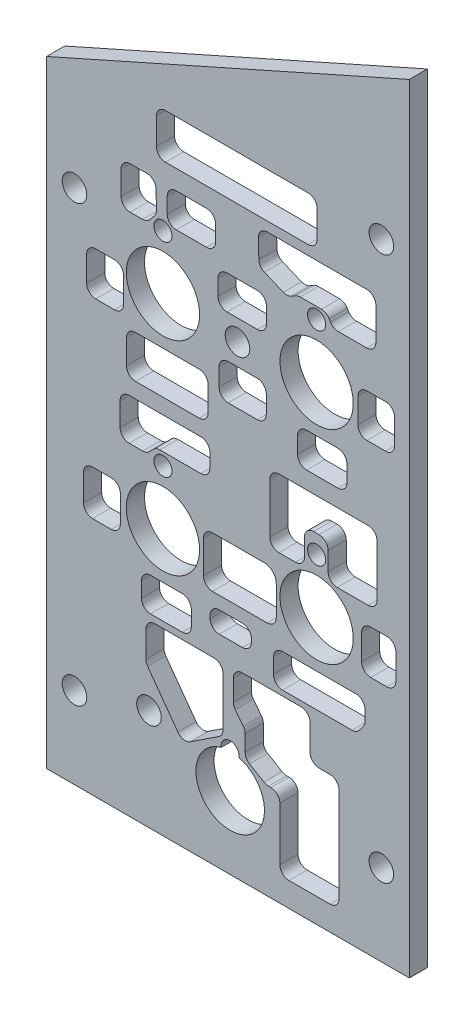
from build123d import *

# Parameters (mm, degrees)
BOSS_EXTRUDE1_DEPTH   = 3.175
F_6_CLEARANCE_HOLE1_D = 4.3053
SKETCH8_R             = 1.5875
SKETCH8_R_2           = 3.75
SKETCH8_R_3           = 6.4135
CUT_EXTRUDE1_DEPTH    = 151.327221464
F_6_CLEARANCE_HOLE2_D = 4.3053
SKETCH11_R            = 6
CUT_EXTRUDE2_DEPTH    = 151.327221464


with BuildPart() as part:
    # Sketch1 → Boss-Extrude1 (new body)
    with BuildSketch(Plane.XY):
        Polygon((0, 107.95), (0, 0), (63.5, 0), (63.5, 136.2202), align=None)
    extrude(amount=-BOSS_EXTRUDE1_DEPTH)

    # #6 Clearance Hole1 (through all)
    with Locations(Plane.XY):
        with Locations((58.6105, 14.2875), (4.8895, 14.2875), (4.8895, 90.4875), (58.6105, 109.5375)):
            Hole(F_6_CLEARANCE_HOLE1_D / 2)

    # Sketch8 → Cut-Extrude1 (cut, through all)
    with BuildSketch(Plane.XY):
        with Locations((20.373230618, 91.71042385)):
            Circle(SKETCH8_R)
        with Locations((47.270485986, 91.71042385)):
            Circle(SKETCH8_R)
        with Locations((47.270485986, 56.073006151)):
            Circle(SKETCH8_R)
        with Locations((32.1439032, 12.7)):
            Circle(SKETCH8_R_2)
        with Locations((20.373230618, 56.073006151)):
            Circle(SKETCH8_R)
        with Locations((32.1439032, 18.7)):
            Circle(SKETCH8_R)
        with Locations((47.270485986, 46.548006151)):
            Circle(SKETCH8_R_3)
        with Locations((47.270485986, 82.18542385)):
            Circle(SKETCH8_R_3)
        with Locations((20.373230618, 82.18542385)):
            Circle(SKETCH8_R_3)
        with Locations((20.373230618, 46.548006151)):
            Circle(SKETCH8_R_3)
    extrude(amount=-CUT_EXTRUDE1_DEPTH, mode=Mode.SUBTRACT)

    # #6 Clearance Hole2 (through all)
    with Locations(Plane(origin=(31.75, 0, 4.765), x_dir=(1, 0, 0), z_dir=(0, 0, 1))):
        with Locations((1.676331213, 81.383391323), (-13.818696068, 17.771227958)):
            Hole(F_6_CLEARANCE_HOLE2_D / 2)

    # Sketch11 → Cut-Extrude2 (cut, through all)
    with BuildSketch(Plane.XY):
        with Locations((32.1439032, 12.7)):
            Circle(SKETCH11_R)
        with BuildLine():
            Line((45.523676241, 74.055426428), (50.989810335, 74.055426428))
            ThreePointArc((50.989810335, 74.055426428), (52.11234235, 73.590458443), (52.577310335, 72.467926428))
            Line((52.577310335, 72.467926428), (52.577310335, 69.601273995))
            ThreePointArc((52.577310335, 69.601273995), (52.11234235, 68.47874198), (50.989810335, 68.013773995))
            Line((50.989810335, 68.013773995), (45.523676241, 68.013773995))
            ThreePointArc((45.523676241, 68.013773995), (44.401144226, 68.47874198), (43.936176241, 69.601273995))
            Line((43.936176241, 69.601273995), (43.936176241, 72.467926428))
            ThreePointArc((43.936176241, 72.467926428), (44.401144226, 73.590458443), (45.523676241, 74.055426428))
        make_face()
        with BuildLine():
            Line((13.983415793, 72.318820405), (13.983415793, 68.071021042))
            ThreePointArc((13.983415793, 68.071021042), (14.448383778, 66.948489027), (15.570915793, 66.483521042))
            Line((15.570915793, 66.483521042), (26.702565391, 66.483521042))
            ThreePointArc((26.702565391, 66.483521042), (27.825097406, 66.948489027), (28.290065391, 68.071021042))
            Line((28.290065391, 68.071021042), (28.290065391, 72.318820405))
            ThreePointArc((28.290065391, 72.318820405), (27.825097406, 73.441352421), (26.702565391, 73.906320405))
            Line((26.702565391, 73.906320405), (15.570915793, 73.906320405))
            ThreePointArc((15.570915793, 73.906320405), (14.448383778, 73.441352421), (13.983415793, 72.318820405))
        make_face()
        with BuildLine():
            Line((56.07814516, 85.295840275), (59.34067888, 85.295840275))
            ThreePointArc((59.34067888, 85.295840275), (60.463210895, 84.83087229), (60.92817888, 83.708340275))
            Line((60.92817888, 83.708340275), (60.92817888, 79.372884269))
            ThreePointArc((60.92817888, 79.372884269), (60.463210895, 78.250352254), (59.34067888, 77.785384269))
            Line((59.34067888, 77.785384269), (56.07814516, 77.785384269))
            ThreePointArc((56.07814516, 77.785384269), (54.955613145, 78.250352254), (54.49064516, 79.372884269))
            Line((54.49064516, 79.372884269), (54.49064516, 83.708340275))
            ThreePointArc((54.49064516, 83.708340275), (54.955613145, 84.83087229), (56.07814516, 85.295840275))
        make_face()
        with BuildLine():
            Line((8.60637042, 83.087952485), (11.892835479, 83.087952485))
            ThreePointArc((11.892835479, 83.087952485), (13.015367495, 82.6229845), (13.480335479, 81.500452485))
            Line((13.480335479, 81.500452485), (13.480335479, 77.084967994))
            ThreePointArc((13.480335479, 77.084967994), (13.015367495, 75.962435979), (11.892835479, 75.497467994))
            Line((11.892835479, 75.497467994), (8.60637042, 75.497467994))
            ThreePointArc((8.60637042, 75.497467994), (7.483838405, 75.962435979), (7.01887042, 77.084967994))
            Line((7.01887042, 77.084967994), (7.01887042, 81.500452485))
            ThreePointArc((7.01887042, 81.500452485), (7.483838405, 82.6229845), (8.60637042, 83.087952485))
        make_face()
        with BuildLine():
            Line((31.78828822, 77.600934156), (36.873010207, 77.600934156))
            ThreePointArc((36.873010207, 77.600934156), (37.995542222, 77.135966171), (38.460510207, 76.013434156))
            Line((38.460510207, 76.013434156), (38.460510207, 72.919427405))
            ThreePointArc((38.460510207, 72.919427405), (37.995542222, 71.79689539), (36.873010207, 71.331927405))
            Line((36.873010207, 71.331927405), (31.78828822, 71.331927405))
            ThreePointArc((31.78828822, 71.331927405), (30.665756205, 71.79689539), (30.20078822, 72.919427405))
            Line((30.20078822, 72.919427405), (30.20078822, 76.013434156))
            ThreePointArc((30.20078822, 76.013434156), (30.665756205, 77.135966171), (31.78828822, 77.600934156))
        make_face()
        with BuildLine():
            Line((20.81246614, 110.162219106), (45.783635223, 110.162219106))
            ThreePointArc((45.783635223, 110.162219106), (46.906167239, 109.697251121), (47.371135223, 108.574719106))
            Line((47.371135223, 108.574719106), (47.371135223, 103.920229342))
            ThreePointArc((47.371135223, 103.920229342), (46.906167239, 102.797697327), (45.783635223, 102.332729342))
            Line((45.783635223, 102.332729342), (20.81246614, 102.332729342))
            ThreePointArc((20.81246614, 102.332729342), (19.689934125, 102.797697327), (19.22496614, 103.920229342))
            Line((19.22496614, 103.920229342), (19.22496614, 108.574719106))
            ThreePointArc((19.22496614, 108.574719106), (19.689934125, 109.697251121), (20.81246614, 110.162219106))
        make_face()
        with BuildLine():
            Line((57.640259875, 99.076538189), (57.640259875, 93.367817873))
            ThreePointArc((57.640259875, 93.367817873), (57.17529189, 92.245285858), (56.052759875, 91.780317873))
            Line((56.052759875, 91.780317873), (51.066940228, 91.780317873))
            ThreePointArc((51.066940228, 91.780317873), (50.288546788, 91.984250057), (49.710140087, 92.543651854))
            Line((49.710140087, 92.543651854), (49.475461226, 92.929996721))
            ThreePointArc((49.475461226, 92.929996721), (48.897054525, 93.489398518), (48.118661085, 93.693330701))
            Line((48.118661085, 93.693330701), (44.395814974, 93.693330701))
            ThreePointArc((44.395814974, 93.693330701), (43.967892068, 93.634568166), (43.571648954, 93.462630842))
            Line((43.571648954, 93.462630842), (42.886204991, 93.046269135))
            ThreePointArc((42.886204991, 93.046269135), (42.183791314, 92.820245022), (41.455073424, 92.936185138))
            Line((41.455073424, 92.936185138), (38.140744016, 94.30758436))
            ThreePointArc((38.140744016, 94.30758436), (37.440797814, 94.873281541), (37.160872185, 95.728605824))
            Line((37.160872185, 95.728605824), (37.065435976, 99.030675516))
            ThreePointArc((37.065435976, 99.030675516), (37.513641885, 100.182736466), (38.652273354, 100.664038189))
            Line((38.652273354, 100.664038189), (56.052759875, 100.664038189))
            ThreePointArc((56.052759875, 100.664038189), (57.17529189, 100.199070205), (57.640259875, 99.076538189))
        make_face()
        with BuildLine():
            Line((13.043142891, 97.422206332), (13.043142891, 93.245591501))
            ThreePointArc((13.043142891, 93.245591501), (13.508110875, 92.123059486), (14.630642891, 91.658091501))
            Line((14.630642891, 91.658091501), (16.822250976, 91.658091501))
            ThreePointArc((16.822250976, 91.658091501), (17.497708726, 91.808958953), (18.044782741, 92.232886049))
            Line((18.044782741, 92.232886049), (18.88582325, 93.248184955))
            ThreePointArc((18.88582325, 93.248184955), (19.164518038, 93.744678159), (19.250104939, 94.307573504))
            Line((19.250104939, 94.307573504), (19.157100928, 97.468889428))
            ThreePointArc((19.157100928, 97.468889428), (18.676191366, 98.561123727), (17.570287474, 99.009706332))
            Line((17.570287474, 99.009706332), (14.630642891, 99.009706332))
            ThreePointArc((14.630642891, 99.009706332), (13.508110875, 98.544738347), (13.043142891, 97.422206332))
        make_face()
        with BuildLine():
            Line((21.127537715, 97.349032062), (21.127537715, 94.608219355))
            ThreePointArc((21.127537715, 94.608219355), (21.5925057, 93.48568734), (22.715037715, 93.020719355))
            Line((22.715037715, 93.020719355), (28.001970212, 93.020719355))
            ThreePointArc((28.001970212, 93.020719355), (29.124502228, 93.48568734), (29.589470212, 94.608219355))
            Line((29.589470212, 94.608219355), (29.589470212, 97.349032062))
            ThreePointArc((29.589470212, 97.349032062), (29.124502228, 98.471564077), (28.001970212, 98.936532062))
            Line((28.001970212, 98.936532062), (22.715037715, 98.936532062))
            ThreePointArc((22.715037715, 98.936532062), (21.5925057, 98.471564077), (21.127537715, 97.349032062))
        make_face()
        with BuildLine():
            Line((30.009904405, 89.345583356), (30.009904405, 86.605821856))
            ThreePointArc((30.009904405, 86.605821856), (30.47487239, 85.483289841), (31.597404405, 85.018321856))
            Line((31.597404405, 85.018321856), (36.905077387, 85.018321856))
            ThreePointArc((36.905077387, 85.018321856), (38.027609402, 85.483289841), (38.492577387, 86.605821856))
            Line((38.492577387, 86.605821856), (38.492577387, 89.345583356))
            ThreePointArc((38.492577387, 89.345583356), (38.027609402, 90.468115371), (36.905077387, 90.933083356))
            Line((36.905077387, 90.933083356), (31.597404405, 90.933083356))
            ThreePointArc((31.597404405, 90.933083356), (30.47487239, 90.468115371), (30.009904405, 89.345583356))
        make_face()
        with BuildLine():
            Line((39.090148146, 54.653046987), (39.090148146, 63.408664196))
            ThreePointArc((39.090148146, 63.408664196), (39.55511613, 64.531196212), (40.677648146, 64.996164196))
            Line((40.677648146, 64.996164196), (56.288341131, 64.996164196))
            ThreePointArc((56.288341131, 64.996164196), (57.410873146, 64.531196212), (57.875841131, 63.408664196))
            Line((57.875841131, 63.408664196), (57.875841131, 54.482830659))
            ThreePointArc((57.875841131, 54.482830659), (57.410873146, 53.360298644), (56.288341131, 52.895330659))
            Line((56.288341131, 52.895330659), (50.875153646, 52.895330659))
            ThreePointArc((50.875153646, 52.895330659), (49.752621631, 53.360298644), (49.287653646, 54.482830659))
            Line((49.287653646, 54.482830659), (49.287653646, 57.713190265))
            ThreePointArc((49.287653646, 57.713190265), (48.822685661, 58.83572228), (47.700153646, 59.300690265))
            Line((47.700153646, 59.300690265), (46.743539126, 59.300690265))
            ThreePointArc((46.743539126, 59.300690265), (45.621007111, 58.83572228), (45.156039126, 57.713190265))
            Line((45.156039126, 57.713190265), (45.156039126, 54.653046987))
            ThreePointArc((45.156039126, 54.653046987), (44.691071141, 53.530514972), (43.568539126, 53.065546987))
            Line((43.568539126, 53.065546987), (40.677648146, 53.065546987))
            ThreePointArc((40.677648146, 53.065546987), (39.55511613, 53.530514972), (39.090148146, 54.653046987))
        make_face()
        with BuildLine():
            Line((55.757973708, 36.817179676), (55.757973708, 35.055222609))
            ThreePointArc((55.757973708, 35.055222609), (55.674596122, 34.547510077), (55.433221564, 34.093129005))
            Line((55.433221564, 34.093129005), (54.730481504, 33.170782676))
            ThreePointArc((54.730481504, 33.170782676), (54.172301833, 32.710294148), (53.467733648, 32.54537628))
            Line((53.467733648, 32.54537628), (41.318555594, 32.54537628))
            ThreePointArc((41.318555594, 32.54537628), (40.196023579, 33.010344265), (39.731055594, 34.13287628))
            Line((39.731055594, 34.13287628), (39.731055594, 36.817179676))
            ThreePointArc((39.731055594, 36.817179676), (40.196023579, 37.939711692), (41.318555594, 38.404679676))
            Line((41.318555594, 38.404679676), (54.170473708, 38.404679676))
            ThreePointArc((54.170473708, 38.404679676), (55.293005723, 37.939711692), (55.757973708, 36.817179676))
        make_face()
        with BuildLine():
            Line((34.269587877, 35.483334493), (30.227048932, 35.483334493))
            ThreePointArc((30.227048932, 35.483334493), (29.104516917, 35.948302478), (28.639548932, 37.070834493))
            Line((28.639548932, 37.070834493), (28.639548932, 37.58840352))
            ThreePointArc((28.639548932, 37.58840352), (29.104516917, 38.710935536), (30.227048932, 39.17590352))
            Line((30.227048932, 39.17590352), (34.269587877, 39.17590352))
            ThreePointArc((34.269587877, 39.17590352), (35.392119892, 38.710935536), (35.857087877, 37.58840352))
            Line((35.857087877, 37.58840352), (35.857087877, 37.070834493))
            ThreePointArc((35.857087877, 37.070834493), (35.392119892, 35.948302478), (34.269587877, 35.483334493))
        make_face()
        with BuildLine():
            Line((25.150321414, 16.633467142), (30.174757754, 19.948911529))
            ThreePointArc((30.174757754, 19.948911529), (30.698306396, 20.521558217), (30.887921328, 21.273936836))
            Line((30.887921328, 21.273936836), (30.887921328, 29.839327273))
            ThreePointArc((30.887921328, 29.839327273), (30.422953343, 30.961859288), (29.300421328, 31.426827273))
            Line((29.300421328, 31.426827273), (18.970323472, 31.426827273))
            ThreePointArc((18.970323472, 31.426827273), (17.847791457, 30.961859288), (17.382823472, 29.839327273))
            Line((17.382823472, 29.839327273), (17.382823472, 25.287149464))
            ThreePointArc((17.382823472, 25.287149464), (17.46010684, 24.797862256), (17.684432256, 24.356214434))
            Line((17.684432256, 24.356214434), (22.990093771, 17.027557418))
            ThreePointArc((22.990093771, 17.027557418), (23.991079525, 16.3967674), (25.150321414, 16.633467142))
        make_face()
        with BuildLine():
            Line((32.688884006, 30.052322821), (32.688884006, 26.428837439))
            ThreePointArc((32.688884006, 26.428837439), (32.775245238, 25.912369966), (33.024932699, 25.452094956))
            Line((33.024932699, 25.452094956), (34.431508608, 23.649919573))
            ThreePointArc((34.431508608, 23.649919573), (34.681196069, 23.189644563), (34.767557301, 22.673177091))
            Line((34.767557301, 22.673177091), (34.767557301, 19.842900038))
            ThreePointArc((34.767557301, 19.842900038), (34.972679906, 19.062394442), (35.535039489, 18.483588802))
            Line((35.535039489, 18.483588802), (38.029821602, 16.978587065))
            ThreePointArc((38.029821602, 16.978587065), (38.424251784, 16.808509071), (38.849839415, 16.750398301))
            Line((38.849839415, 16.750398301), (39.259349583, 16.750398301))
            ThreePointArc((39.259349583, 16.750398301), (40.381881598, 16.285430316), (40.846849583, 15.162898301))
            Line((40.846849583, 15.162898301), (40.846849583, 5.844257673))
            ThreePointArc((40.846849583, 5.844257673), (41.311817568, 4.721725657), (42.434349583, 4.256757673))
            Line((42.434349583, 4.256757673), (49.615792499, 4.256757673))
            ThreePointArc((49.615792499, 4.256757673), (50.738324514, 4.721725657), (51.203292499, 5.844257673))
            Line((51.203292499, 5.844257673), (51.203292499, 22.332433259))
            ThreePointArc((51.203292499, 22.332433259), (50.738324514, 23.454965274), (49.615792499, 23.919933259))
            Line((49.615792499, 23.919933259), (47.714362344, 23.919933259))
            ThreePointArc((47.714362344, 23.919933259), (46.591830329, 24.384901244), (46.126862344, 25.507433259))
            Line((46.126862344, 25.507433259), (46.126862344, 30.052322821))
            ThreePointArc((46.126862344, 30.052322821), (45.661894359, 31.174854836), (44.539362344, 31.639822821))
            Line((44.539362344, 31.639822821), (34.276384006, 31.639822821))
            ThreePointArc((34.276384006, 31.639822821), (33.15385199, 31.174854836), (32.688884006, 30.052322821))
        make_face()
        with BuildLine():
            Line((38.100030376, 50.257832926), (29.05413027, 50.257832926))
            ThreePointArc((29.05413027, 50.257832926), (27.931598255, 49.792864941), (27.46663027, 48.670332926))
            Line((27.46663027, 48.670332926), (27.46663027, 42.968341437))
            ThreePointArc((27.46663027, 42.968341437), (27.931598255, 41.845809422), (29.05413027, 41.380841437))
            Line((29.05413027, 41.380841437), (38.620834463, 41.380841437))
            ThreePointArc((38.620834463, 41.380841437), (39.743366478, 41.845809422), (40.208334463, 42.968341437))
            Line((40.208334463, 42.968341437), (40.208334463, 48.149528839))
            ThreePointArc((40.208334463, 48.149528839), (39.590826493, 49.640324955), (38.100030376, 50.257832926))
        make_face()
        with BuildLine():
            Line((12.87551174, 62.215836911), (12.87551174, 58.137854493))
            ThreePointArc((12.87551174, 58.137854493), (13.340479724, 57.015322478), (14.46301174, 56.550354493))
            Line((14.46301174, 56.550354493), (16.841693414, 56.550354493))
            ThreePointArc((16.841693414, 56.550354493), (17.449203363, 56.671195735), (17.96422543, 57.015322478))
            Line((17.96422543, 57.015322478), (18.708007685, 57.759104733))
            ThreePointArc((18.708007685, 57.759104733), (19.223029751, 58.103231476), (19.8305397, 58.224072718))
            Line((19.8305397, 58.224072718), (27.005776878, 58.224072718))
            ThreePointArc((27.005776878, 58.224072718), (28.128308893, 58.689040703), (28.593276878, 59.811572718))
            Line((28.593276878, 59.811572718), (28.593276878, 62.215836911))
            ThreePointArc((28.593276878, 62.215836911), (28.128308893, 63.338368926), (27.005776878, 63.803336911))
            Line((27.005776878, 63.803336911), (14.46301174, 63.803336911))
            ThreePointArc((14.46301174, 63.803336911), (13.340479724, 63.338368926), (12.87551174, 62.215836911))
        make_face()
        with BuildLine():
            Line((11.33338567, 41.924174444), (8.056598929, 41.924174444))
            ThreePointArc((8.056598929, 41.924174444), (6.934066914, 42.389142429), (6.469098929, 43.511674444))
            Line((6.469098929, 43.511674444), (6.469098929, 48.149528839))
            ThreePointArc((6.469098929, 48.149528839), (6.934066914, 49.272060854), (8.056598929, 49.737028839))
            Line((8.056598929, 49.737028839), (11.33338567, 49.737028839))
            ThreePointArc((11.33338567, 49.737028839), (12.455917685, 49.272060854), (12.92088567, 48.149528839))
            Line((12.92088567, 48.149528839), (12.92088567, 43.511674444))
            ThreePointArc((12.92088567, 43.511674444), (12.455917685, 42.389142429), (11.33338567, 41.924174444))
        make_face()
        with BuildLine():
            Line((18.202144421, 38.404679676), (23.751864408, 38.404679676))
            ThreePointArc((23.751864408, 38.404679676), (24.874396424, 37.939711692), (25.339364408, 36.817179676))
            Line((25.339364408, 36.817179676), (25.339364408, 34.13287628))
            ThreePointArc((25.339364408, 34.13287628), (24.874396424, 33.010344265), (23.751864408, 32.54537628))
            Line((23.751864408, 32.54537628), (18.202144421, 32.54537628))
            ThreePointArc((18.202144421, 32.54537628), (17.079612405, 33.010344265), (16.614644421, 34.13287628))
            Line((16.614644421, 34.13287628), (16.614644421, 36.817179676))
            ThreePointArc((16.614644421, 36.817179676), (17.079612405, 37.939711692), (18.202144421, 38.404679676))
        make_face()
        with BuildLine():
            Line((56.737596555, 49.829116209), (59.556417389, 49.829116209))
            ThreePointArc((59.556417389, 49.829116209), (60.678949404, 49.364148225), (61.143917389, 48.241616209))
            Line((61.143917389, 48.241616209), (61.143917389, 43.759828603))
            ThreePointArc((61.143917389, 43.759828603), (60.678949404, 42.637296588), (59.556417389, 42.172328603))
            Line((59.556417389, 42.172328603), (56.737596555, 42.172328603))
            ThreePointArc((56.737596555, 42.172328603), (55.61506454, 42.637296588), (55.150096555, 43.759828603))
            Line((55.150096555, 43.759828603), (55.150096555, 48.241616209))
            ThreePointArc((55.150096555, 48.241616209), (55.61506454, 49.364148225), (56.737596555, 49.829116209))
        make_face()
    extrude(amount=-CUT_EXTRUDE2_DEPTH, mode=Mode.SUBTRACT)


solid = part.part
